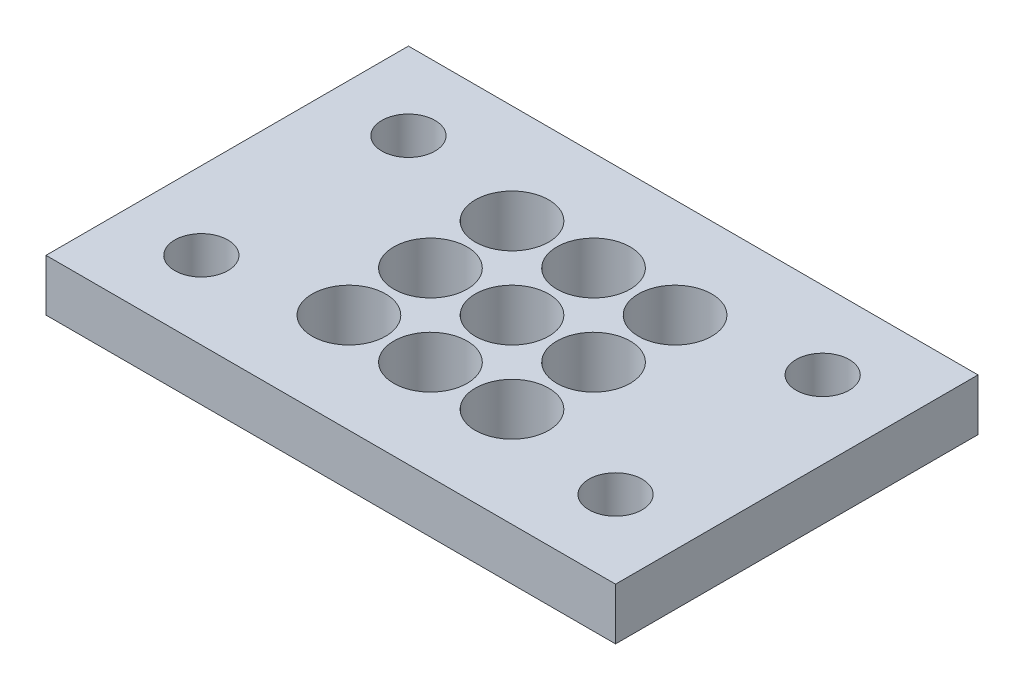
from build123d import *

# Parameters (mm, degrees)
SKETCH1_W           = 69.85
SKETCH1_H           = 44.45
SKETCH1_R           = 3.2639
SKETCH1_R_2         = 4.5
BOSS_EXTRUDE1_DEPTH = 6.35


with BuildPart() as part:
    # Sketch1 → Boss-Extrude1 (new body)
    with BuildSketch(Plane(origin=(0, 0, 0), x_dir=(1, 0, 0), z_dir=(0, 1, 0))):
        with Locations((34.925, 22.225)):
            Rectangle(SKETCH1_W, SKETCH1_H)
        with Locations((9.525, 9.525)):
            Circle(SKETCH1_R, mode=Mode.SUBTRACT)
        with Locations((24.925, 12.225)):
            Circle(SKETCH1_R_2, mode=Mode.SUBTRACT)
        with Locations((24.925, 22.225)):
            Circle(SKETCH1_R_2, mode=Mode.SUBTRACT)
        with Locations((60.325, 9.525)):
            Circle(SKETCH1_R, mode=Mode.SUBTRACT)
        with Locations((34.925, 12.225)):
            Circle(SKETCH1_R_2, mode=Mode.SUBTRACT)
        with Locations((44.925, 12.225)):
            Circle(SKETCH1_R_2, mode=Mode.SUBTRACT)
        with Locations((24.925, 32.225)):
            Circle(SKETCH1_R_2, mode=Mode.SUBTRACT)
        with Locations((34.925, 32.225)):
            Circle(SKETCH1_R_2, mode=Mode.SUBTRACT)
        with Locations((9.525, 34.925)):
            Circle(SKETCH1_R, mode=Mode.SUBTRACT)
        with Locations((34.925, 22.225)):
            Circle(SKETCH1_R_2, mode=Mode.SUBTRACT)
        with Locations((44.925, 22.225)):
            Circle(SKETCH1_R_2, mode=Mode.SUBTRACT)
        with Locations((44.925, 32.225)):
            Circle(SKETCH1_R_2, mode=Mode.SUBTRACT)
        with Locations((60.325, 34.925)):
            Circle(SKETCH1_R, mode=Mode.SUBTRACT)
    extrude(amount=BOSS_EXTRUDE1_DEPTH)


solid = part.part
